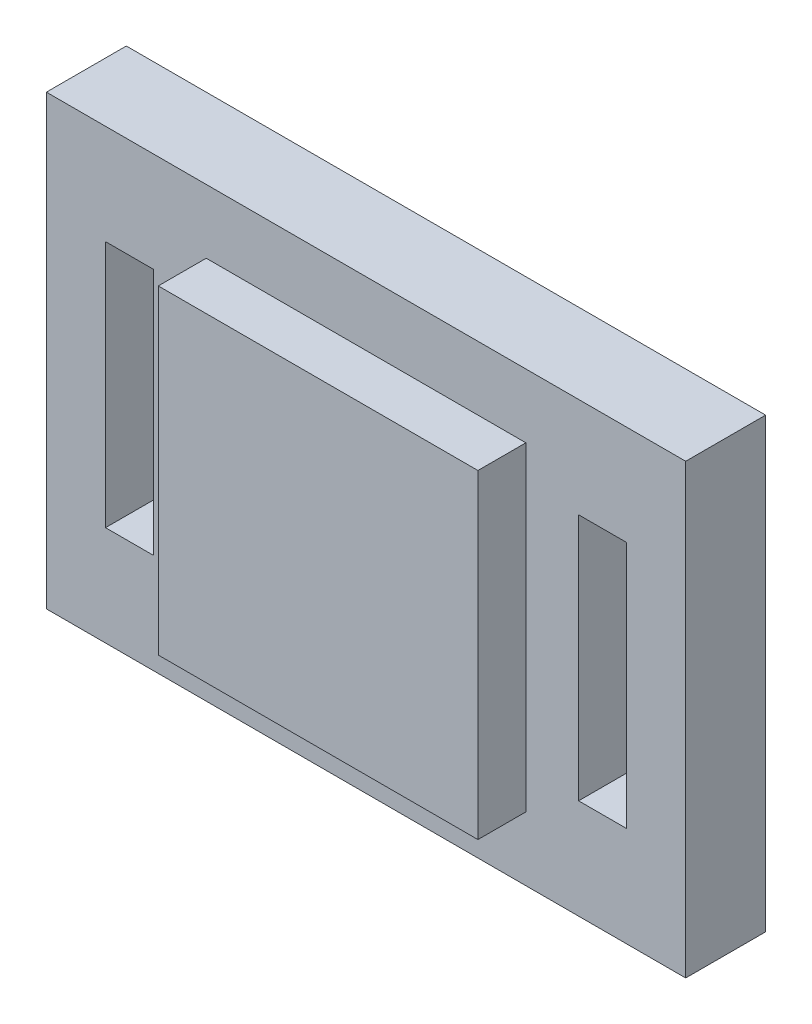
from build123d import *

# Parameters (mm, degrees)
CROQUIS1_W              = 40
CROQUIS1_H              = 28
CROQUIS1_W_2            = 3
CROQUIS1_H_2            = 15.5
SALIENTE_EXTRUIR1_DEPTH = 2.5
CROQUIS2_W              = 20
CROQUIS2_H              = 20
SALIENTE_EXTRUIR2_DEPTH = 3


with BuildPart() as part:
    # Croquis1 → Saliente-Extruir1 (new, symmetric)
    with BuildSketch(Plane.XY):
        Rectangle(CROQUIS1_W, CROQUIS1_H)
        with Locations((14.8, 0)):
            Rectangle(CROQUIS1_W_2, CROQUIS1_H_2, mode=Mode.SUBTRACT)
        with Locations((-14.8, 0)):
            Rectangle(CROQUIS1_W_2, CROQUIS1_H_2, mode=Mode.SUBTRACT)
    extrude(amount=SALIENTE_EXTRUIR1_DEPTH, both=True)

    # Croquis2 → Saliente-Extruir2 (add)
    with BuildSketch(Plane.XY.offset(2.5)):
        Rectangle(CROQUIS2_W, CROQUIS2_H)
    extrude(amount=SALIENTE_EXTRUIR2_DEPTH)


solid = part.part
